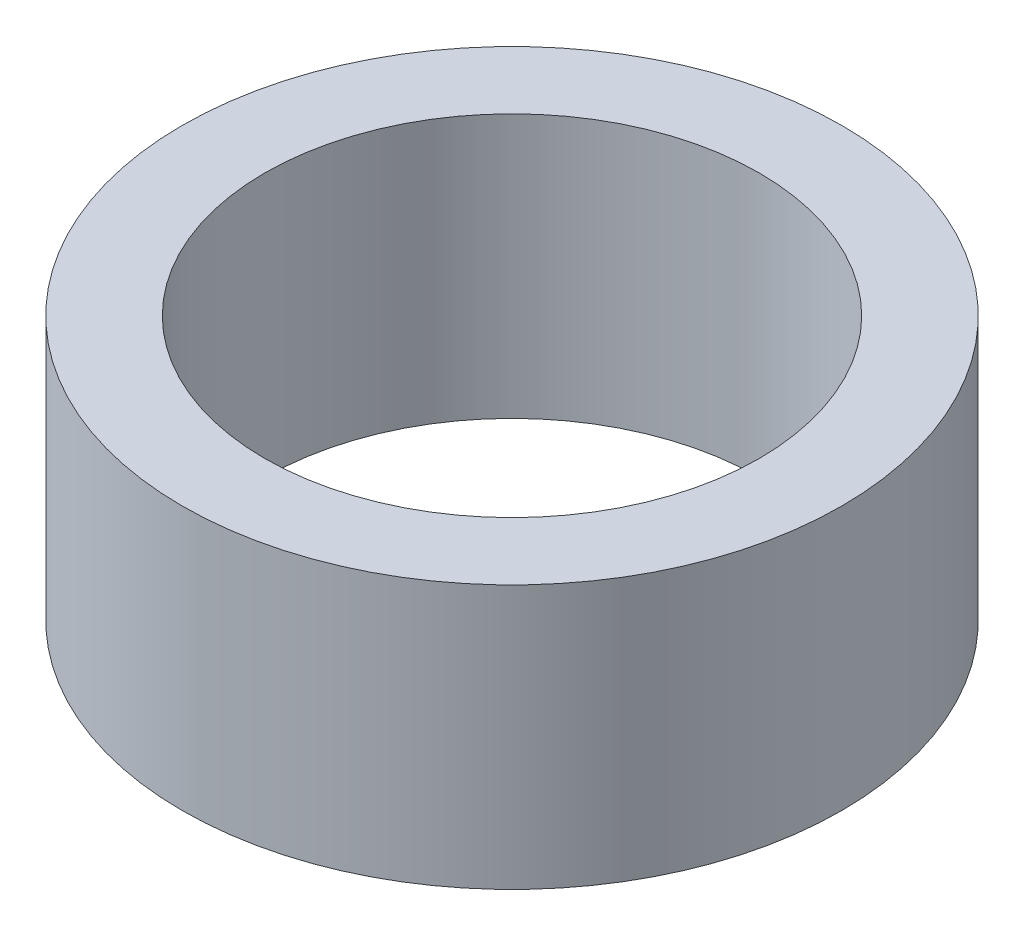
from build123d import *

# Parameters (mm, degrees)
SKETCH1_R           = 30
BOSS_EXTRUDE1_DEPTH = 24
SKETCH2_R           = 22.5
CUT_EXTRUDE1_DEPTH  = 49.744230428


with BuildPart() as part:
    # Sketch1 → Boss-Extrude1 (new body)
    with BuildSketch(Plane(origin=(0, 0, 0), x_dir=(1, 0, 0), z_dir=(0, 1, 0))):
        Circle(SKETCH1_R)
    extrude(amount=BOSS_EXTRUDE1_DEPTH)

    # Sketch2 → Cut-Extrude1 (cut, through all)
    with BuildSketch(Plane(origin=(0, 0, 0), x_dir=(1, 0, 0), z_dir=(0, 1, 0))):
        Circle(SKETCH2_R)
    extrude(amount=CUT_EXTRUDE1_DEPTH, mode=Mode.SUBTRACT)


solid = part.part
